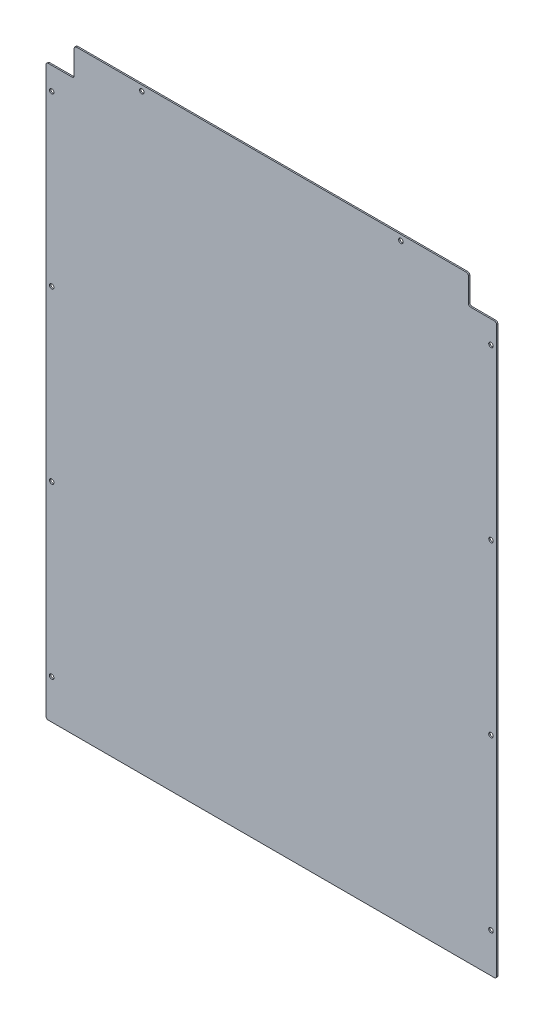
from build123d import *

# Parameters (mm, degrees)
TABAN_FLAN_1_DEPTH    = 1.2
K_ELERI_START         = -1.2
K_ELERI_K_R1_DEPTH    = 1.2
K_ELERI_K_R1_2_DEPTH  = 1.2
IZIM2_R               = 2
KES_EKSTR_ZYON1_DEPTH = 10


# Read off the part's stored shape, not the designer's step: Köşeleri kır1
# Sheet-metal steps are written as plain solids
with BuildPart() as part:
    # Çizim1 → Taban-Flanş1 (new body)
    with BuildSketch(Plane.XY):
        Polygon((-200, 0), (200, 0), (200, 505), (175, 505), (175, 530), (-175, 530), (-175, 505), (-200, 505), align=None)
    extrude(amount=-TABAN_FLAN_1_DEPTH)

    # Köşeleri kır1 outline → Köşeleri kır1 (cut)
    with BuildSketch(Plane.XY.offset(K_ELERI_START)):
        with BuildLine():
            ThreePointArc((200, 2), (199.414213562, 0.585786438), (198, 0))
            Line((198, 0), (200, 0))
            Line((200, 0), (200, 2))
        make_face()
        with BuildLine():
            Line((-200, 0), (-198, 0))
            ThreePointArc((-198, 0), (-199.414213562, 0.585786438), (-200, 2))
            Line((-200, 2), (-200, 0))
        make_face()
        with BuildLine():
            ThreePointArc((198, 505), (199.414213562, 504.414213562), (200, 503))
            Line((200, 503), (200, 505))
            Line((200, 505), (198, 505))
        make_face()
        with BuildLine():
            Line((-200, 505), (-200, 503))
            ThreePointArc((-200, 503), (-199.414213562, 504.414213562), (-198, 505))
            Line((-198, 505), (-200, 505))
        make_face()
        with BuildLine():
            ThreePointArc((173, 530), (174.414213562, 529.414213562), (175, 528))
            Line((175, 528), (175, 530))
            Line((175, 530), (173, 530))
        make_face()
        with BuildLine():
            Line((-175, 530), (-175, 528))
            ThreePointArc((-175, 528), (-174.414213562, 529.414213562), (-173, 530))
            Line((-173, 530), (-175, 530))
        make_face()
    extrude(amount=K_ELERI_K_R1_DEPTH, mode=Mode.SUBTRACT)

    # K_eleri k_r1 2 outline → K_eleri k_r1 2 (add)
    with BuildSketch(Plane.XY.offset(K_ELERI_START)):
        with BuildLine():
            Line((175, 505), (177, 505))
            ThreePointArc((177, 505), (175.585786438, 505.585786438), (175, 507))
            Line((175, 507), (175, 505))
        make_face()
        with BuildLine():
            ThreePointArc((-175, 507), (-175.585786438, 505.585786438), (-177, 505))
            Line((-177, 505), (-175, 505))
            Line((-175, 505), (-175, 507))
        make_face()
    extrude(amount=K_ELERI_K_R1_2_DEPTH)

    # Çizim2 → Kes-Ekstrüzyon1 (cut)
    with BuildSketch(Plane.XY):
        with Locations((-195, 485)):
            Circle(IZIM2_R)
        with Locations((-195, 335)):
            Circle(IZIM2_R)
        with Locations((-195, 185)):
            Circle(IZIM2_R)
        with Locations((-195, 35)):
            Circle(IZIM2_R)
        with Locations((-115, 525)):
            Circle(IZIM2_R)
        with Locations(Location((115, 525, 0), (0, 0, 180))):
            Circle(IZIM2_R)
        with Locations(Location((195, 35, 0), (0, 0, 180))):
            Circle(IZIM2_R)
        with Locations(Location((195, 185, 0), (0, 0, 180))):
            Circle(IZIM2_R)
        with Locations(Location((195, 335, 0), (0, 0, 180))):
            Circle(IZIM2_R)
        with Locations(Location((195, 485, 0), (0, 0, 180))):
            Circle(IZIM2_R)
    extrude(amount=-KES_EKSTR_ZYON1_DEPTH, mode=Mode.SUBTRACT)


solid = part.part
